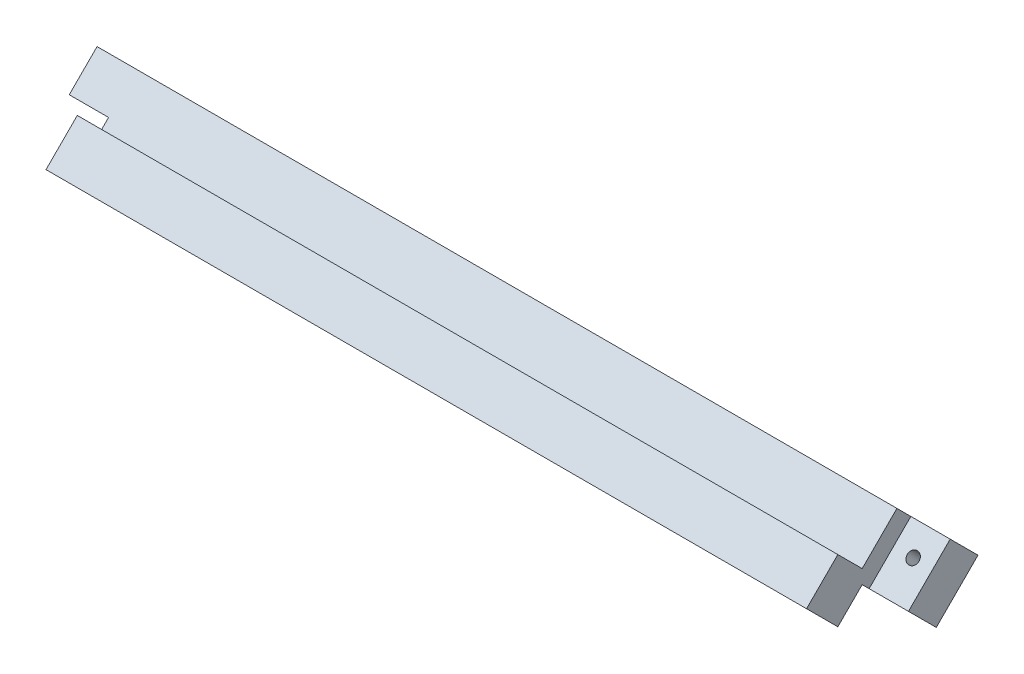
from build123d import *

# Parameters (mm, degrees)
STOCK_GOUX_START         = 18.606590305
STOCK_GOUX_LIKED_1_DEPTH = 85.344287899
BOSS_EXTRUDE1_DEPTH      = 85.344288
SKETCH2_W                = 4
SKETCH2_H                = 5.500000112
CUT_EXTRUDE1_DEPTH       = 157.288398843
SKETCH3_R                = 0.6
CUT_EXTRUDE2_DEPTH       = 157.307592951
CIRPATTERN1_COUNT        = 2
CUT_EXTRUDE3_DEPTH       = 0.4


# Read off the part's stored shape, not the designer's step: Stock-Goux Liked-1
with BuildPart() as part:
    # Stock-Goux Liked-1 outline → Stock-Goux Liked-1 (new body)
    with BuildSketch(Plane.YZ.offset(STOCK_GOUX_START)):
        Polygon((-4.242640464, 151.610592485), (-3.889087062, 151.257039083), (0, 155.146126145), (3.889087062, 151.257039083), (4.242640464, 151.610592485), (0.707106624, 155.146126325), (3.181980438, 157.621000138), (0, 160.802980576), (-3.181980438, 157.621000138), (-0.707106624, 155.146126325), align=None)
    extrude(amount=STOCK_GOUX_LIKED_1_DEPTH)

    # Sketch1 → Boss-Extrude1 (add)
    with BuildSketch(Plane.ZY.offset(-18.606590305)):
        Polygon((151.257039083, 3.889087062), (147.367952022, 0), (151.257039083, -3.889087062), (155.146126145, 0), align=None)
    extrude(amount=-BOSS_EXTRUDE1_DEPTH)

    # Sketch2 → Cut-Extrude1 (cut, symmetric)
    with BuildSketch(Plane(origin=(0, 77.926616474, 77.926616474), x_dir=(1, 0, 0), z_dir=(-7.406550393246798e-15, 0.7071067811865402, 0.7071067811865549))):
        with Locations((20.606590305, -110.954877944)):
            Rectangle(SKETCH2_W, SKETCH2_H)
    cut_extrude1 = extrude(amount=CUT_EXTRUDE1_DEPTH, both=True, mode=Mode.SUBTRACT)

    # Sketch3 → Cut-Extrude2 (cut, through all)
    with BuildSketch(Plane(origin=(0, -76.512402912, 76.512402912), x_dir=(1, 0, 0), z_dir=(4.90653893338685e-15, -0.7071067811865547, 0.7071067811865404))):
        with Locations(Location((20.606590305, 106.704878157, 0), (0, 0, 270))):
            Circle(SKETCH3_R)
    cut_extrude2 = extrude(amount=-CUT_EXTRUDE2_DEPTH, mode=Mode.SUBTRACT)

    # CirPattern1: Cut-Extrude1, Cut-Extrude2 ×2 about axis
    cirpattern1_axis = Axis((61.278734255, 0, 0), (0, 0, 1))
    add([cut_extrude1.rotate(cirpattern1_axis, i * 360 / CIRPATTERN1_COUNT) for i in range(1, CIRPATTERN1_COUNT)], mode=Mode.SUBTRACT)
    add([cut_extrude2.rotate(cirpattern1_axis, i * 360 / CIRPATTERN1_COUNT) for i in range(1, CIRPATTERN1_COUNT)], mode=Mode.SUBTRACT)

    # Sketch4 → Cut-Extrude3 (cut)
    with BuildSketch(Plane(origin=(0, -73.683976011, 73.683976011), x_dir=(1, 0, 0), z_dir=(-7.520852272753644e-15, 0.7071067811865547, -0.7071067811865404))):
        Polygon((58.529858576, -104.856160255), (58.529858576, -108.763852563), (52.017038063, -105.42603205), (52.287981573, -104.933754406), (57.878576525, -107.799649839), (57.878576525, -104.856160255), align=None)
    extrude(amount=-CUT_EXTRUDE3_DEPTH, mode=Mode.SUBTRACT)


solid = part.part
